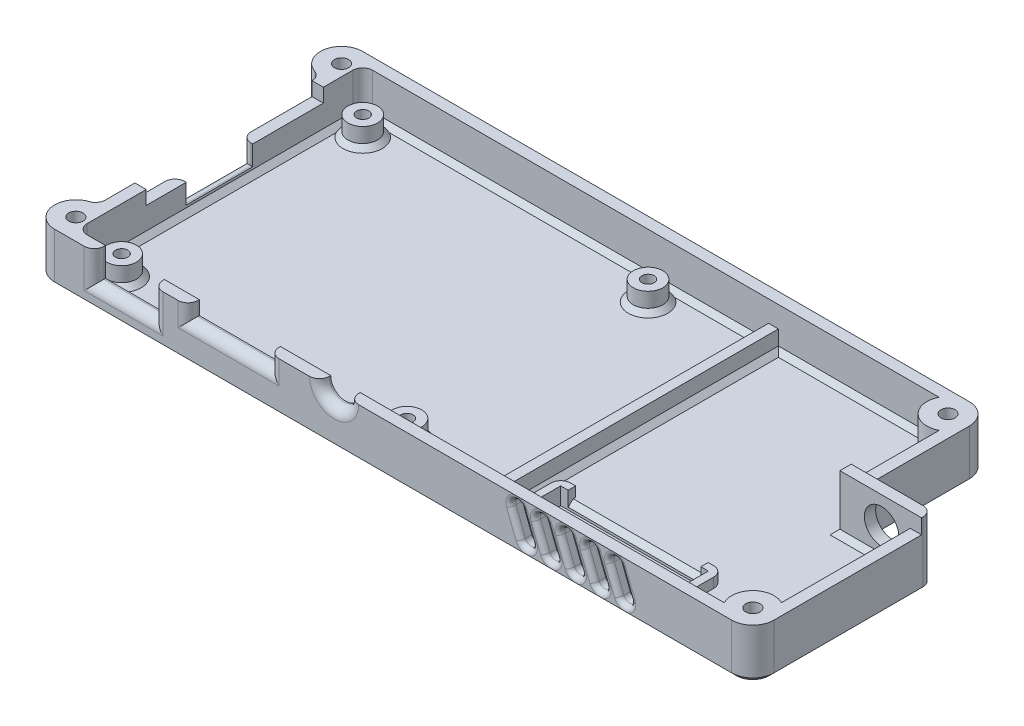
from build123d import *

# Parameters (mm, degrees)
BOSS_EXTRUDE1_DEPTH            = 10.3
BOSS_EXTRUDE2_DEPTH            = 2
SKETCH6_R                      = 3
BOSS_EXTRUDE3_DEPTH            = 4
F_2_5_2_5_DIAMETER_HOLE1_D     = 2.5
F_2_5_2_5_DIAMETER_HOLE1_DEPTH = 8
F_2_5_2_5_DIAMETER_HOLE1_TIP   = 0.751075774
SKETCH10_W                     = 2
SKETCH10_H                     = 58
BOSS_EXTRUDE4_DEPTH            = 4
CUT_EXTRUDE1_REACH             = 100.128
SKETCH11_R                     = 3
SKETCH11_W                     = 12
SKETCH11_H                     = 5.8
SKETCH11_W_2                   = 16.5
SKETCH11_H_2                   = 2.8
CUT_EXTRUDE2_REACH             = 148.374
SKETCH12_W                     = 13.5
SKETCH12_H                     = 6.8
SKETCH12_W_2                   = 36
SKETCH12_H_2                   = 2.8
FILLET6_R                      = 2
FILLET8_R                      = 2
CHAMFER1_SIZE                  = 1
FILLET9_R                      = 2
SKETCH14_W                     = 16.6
SKETCH14_H                     = 2.3
BOSS_EXTRUDE5_DEPTH            = 3
CUT_EXTRUDE3_REACH             = 86.384
SKETCH13_R                     = 3.5
BOSS_EXTRUDE6_DEPTH            = 10.3
F_2_9_2_9_DIAMETER_HOLE2_D     = 2.9
F_2_9_2_9_DIAMETER_HOLE1_D     = 2.9
BOSS_EXTRUDE7_REACH            = 89.052
SKETCH24_R                     = 4.3
F_2_9_2_9_DIAMETER_HOLE3_D     = 2.9
F_2_9_2_9_DIAMETER_HOLE4_D     = 2.9
FILLET10_R                     = 4.3
FILLET16_R                     = 4.3
FILLET17_R                     = 2
FILLET18_R                     = 2
FILLET19_R                     = 2
SKETCH29_W                     = 30.1
SKETCH29_H                     = 10.25
CUT_EXTRUDE4_DEPTH             = 1.5
CUT_EXTRUDE4_DIRECTION_2_REACH = 89.052
BOSS_EXTRUDE8_DEPTH            = 2
CHAMFER3_SIZE                  = 1
FILLET20_R                     = 2
CUT_EXTRUDE5_REACH             = 103.795
CHAMFER5_SIZE                  = 1
FILLET21_R                     = 1


with BuildPart() as part:
    # Sketch3 → Boss-Extrude1 (new body)
    with BuildSketch(Plane(origin=(0, 0, 0), x_dir=(1, 0, 0), z_dir=(0, 1, 0))):
        Polygon((52.738233838, 8.405993834), (67.038233838, 8.405993834), (67.038233838, -28.194006166), (52.738233838, -28.194006166), (-74.861766162, -28.194006166), (-74.861766162, 34.405993834), (52.738233838, 34.405993834), align=None)
        Polygon((55.038233838, -25.894006166), (64.738233838, -25.894006166), (64.738233838, 6.105993834), (50.438233838, 6.105993834), (50.438233838, 32.105993834), (-72.561766162, 32.105993834), (-72.561766162, -25.894006166), (50.438233838, -25.894006166), align=None, mode=Mode.SUBTRACT)
    extrude(amount=BOSS_EXTRUDE1_DEPTH)

    # Sketch5 → Boss-Extrude2 (add)
    with BuildSketch(Plane(origin=(0, 0, 0), x_dir=(1, 0, 0), z_dir=(0, 1, 0))):
        Polygon((-72.561766162, 32.105993834), (50.438233838, 32.105993834), (50.438233838, 6.105993834), (64.738233838, 6.105993834), (64.738233838, -25.894006166), (50.438233838, -25.894006166), (-72.561766162, -25.894006166), align=None)
    extrude(amount=BOSS_EXTRUDE2_DEPTH)

    # Sketch6 → Boss-Extrude3 (add)
    with BuildSketch(Plane(origin=(0, 2, 0), x_dir=(1, 0, 0), z_dir=(0, 1, 0))):
        with Locations(Location((-68.061766162, 27.605993834, 0), (0, 0, 270))):
            Circle(SKETCH6_R)
        with Locations(Location((-68.061766162, -21.394006166, 0), (0, 0, 270))):
            Circle(SKETCH6_R)
        with Locations(Location((-10.061766162, -21.394006166, 0), (0, 0, 270))):
            Circle(SKETCH6_R)
        with Locations(Location((-10.061766162, 27.605993834, 0), (0, 0, 270))):
            Circle(SKETCH6_R)
    extrude(amount=BOSS_EXTRUDE3_DEPTH)

    # Ø2.5 (2.5) Diameter Hole1
    with Locations(Plane(origin=(0, 6, 0), x_dir=(1, 0, 0), z_dir=(0, 1, 0))):
        with Locations((-68.061766162, 27.605993834), (-10.061766162, 27.605993834), (-10.061766162, -21.394006166), (-68.061766162, -21.394006166)):
            Hole(F_2_5_2_5_DIAMETER_HOLE1_D / 2, depth=F_2_5_2_5_DIAMETER_HOLE1_DEPTH)
            with Locations((0, 0, -(F_2_5_2_5_DIAMETER_HOLE1_DEPTH + F_2_5_2_5_DIAMETER_HOLE1_TIP / 2))):  # 118° drill point
                Cone(0, F_2_5_2_5_DIAMETER_HOLE1_D / 2, F_2_5_2_5_DIAMETER_HOLE1_TIP, mode=Mode.SUBTRACT)

    # Sketch10 → Boss-Extrude4 (add)
    with BuildSketch(Plane(origin=(0, 2, 0), x_dir=(1, 0, 0), z_dir=(0, 1, 0))):
        with Locations((10.938233838, 3.105993834)):
            Rectangle(SKETCH10_W, SKETCH10_H)
    extrude(amount=BOSS_EXTRUDE4_DEPTH)

    # Sketch11 → Cut-Extrude1 (cut, up to next)
    with BuildSketch(Plane.XY.offset(28.194006166), mode=Mode.PRIVATE) as cut_extrude1_sk1:
        with Locations((-18.061766162, 10.3)):
            Circle(SKETCH11_R)
    cut_extrude1_tool1 = extrude(cut_extrude1_sk1.sketch, amount=-CUT_EXTRUDE1_REACH, mode=Mode.PRIVATE) & part.part
    # Sketch11 → Cut-Extrude1 (cut, up to next)
    with BuildSketch(Plane.XY.offset(28.194006166), mode=Mode.PRIVATE) as cut_extrude1_sk2:
        with Locations((-60.861766162, 7.4)):
            Rectangle(SKETCH11_W, SKETCH11_H)
    cut_extrude1_tool2 = extrude(cut_extrude1_sk2.sketch, amount=-CUT_EXTRUDE1_REACH, mode=Mode.PRIVATE) & part.part
    # Sketch11 → Cut-Extrude1 (cut, up to next)
    with BuildSketch(Plane.XY.offset(28.194006166), mode=Mode.PRIVATE) as cut_extrude1_sk3:
        with Locations((-39.527982648, 8.9)):
            Rectangle(SKETCH11_W_2, SKETCH11_H_2)
    cut_extrude1_tool3 = extrude(cut_extrude1_sk3.sketch, amount=-CUT_EXTRUDE1_REACH, mode=Mode.PRIVATE) & part.part
    add(cut_extrude1_tool1.solids().sort_by_distance((-18.061766, 10.3, 28.194006))[0], mode=Mode.SUBTRACT)
    add(cut_extrude1_tool2.solids().sort_by_distance((-60.861766, 7.4, 28.194006))[0], mode=Mode.SUBTRACT)
    add(cut_extrude1_tool3.solids().sort_by_distance((-39.527983, 8.9, 28.194006))[0], mode=Mode.SUBTRACT)

    # Sketch12 → Cut-Extrude2 (cut, up to next)
    with BuildSketch(Plane.ZY.offset(74.861766162), mode=Mode.PRIVATE) as cut_extrude2_sk1:
        with Locations((-2.982922372, 6.9)):
            Rectangle(SKETCH12_W, SKETCH12_H)
    cut_extrude2_tool1 = extrude(cut_extrude2_sk1.sketch, amount=-CUT_EXTRUDE2_REACH, mode=Mode.PRIVATE) & part.part
    # Sketch12 → Cut-Extrude2 (cut, up to next)
    with BuildSketch(Plane.ZY.offset(74.861766162), mode=Mode.PRIVATE) as cut_extrude2_sk2:
        with Locations((-6.105993834, 8.9)):
            Rectangle(SKETCH12_W_2, SKETCH12_H_2)
    cut_extrude2_tool2 = extrude(cut_extrude2_sk2.sketch, amount=-CUT_EXTRUDE2_REACH, mode=Mode.PRIVATE) & part.part
    add(cut_extrude2_tool1.solids().sort_by_distance((-74.861766, 6.9, -2.982922))[0], mode=Mode.SUBTRACT)
    add(cut_extrude2_tool2.solids().sort_by_distance((-74.861766, 8.9, -6.105994))[0], mode=Mode.SUBTRACT)

    # Fillet6
    fillet6_edges = [part.edges().sort_by_distance(p)[0] for p in [
        (50.438233838, 6.15, -32.105993834),
    ]]
    fillet(fillet6_edges, radius=FILLET6_R)

    # Fillet8
    fillet8_edges = [part.edges().sort_by_distance(p)[0] for p in [
        (-72.561766162, 6.15, -32.105993834),
        (-72.561766162, 6.15, 25.894006166),
    ]]
    fillet(fillet8_edges, radius=FILLET8_R)

    # Chamfer1
    chamfer1_edges = [part.edges().sort_by_distance(p)[0] for p in [
        (-68.061766162, 2, -30.605993834),
        (-68.061766162, 2, 18.394006166),
        (-10.061766162, 2, 18.394006166),
        (-10.061766162, 2, -30.605993834),
    ]]
    chamfer(chamfer1_edges, length=CHAMFER1_SIZE)

    # Chamfer2
    # the kernel refuses this chamfer: 1 mm, written as the material it adds along each edge
    with BuildSketch(Plane(origin=(64.738233838, 2, 25.894006166), x_dir=(0, 0.9996219169112968, 0.027495876610585623), z_dir=(-1, 0, 0))) as chamfer2_piece_1:
        with BuildLine():
            Line((1.028673195, 0), (-0.056547155, 1.027117794))
            Line((-0.056547155, 1.027117794), (-0.076539593, 1.026567876))
            ThreePointArc((-0.076539593, 1.026567876), (-0.034129227, 0.51339783), (-0.019992438, -0.000549918))
            Line((-0.019992438, -0.000549918), (0.000549918, -0.019992438))
            ThreePointArc((0.000549918, -0.019992438), (0.514497665, -0.00585565), (1.029223113, -0.019992438))
            Line((1.029223113, -0.019992438), (1.028673195, 0))
        make_face()
    extrude(amount=52.8)
    with BuildSketch(Plane(origin=(-70.561766162, 2, -32.105993834), x_dir=(0, -0.027495876610586296, 0.9996219169112968), z_dir=(1, 0, 0)), Plane(origin=(9.938233838, 2, 25.894006166), x_dir=(0, -0.02749587661058759, -0.9996219169112968), z_dir=(-1, 0, 0))) as chamfer2_piece_2:
        with BuildLine():
            Line((1.028673195, 0), (-0.056547155, -1.027117794))
            Line((-0.056547155, -1.027117794), (-0.076539593, -1.026567876))
            ThreePointArc((-0.076539593, -1.026567876), (-0.034129227, -0.51339783), (-0.019992438, 0.000549918))
            Line((-0.019992438, 0.000549918), (0.000549918, 0.019992438))
            ThreePointArc((0.000549918, 0.019992438), (0.514497665, 0.00585565), (1.029223113, 0.019992438))
            Line((1.029223113, 0.019992438), (1.028673195, 0))
        make_face()
    extrude(amount=80.5)
    with BuildSketch(Plane(origin=(9.938233838, 2, 25.894006166), x_dir=(-0.9996219169112968, -0.027495876610586556, 0), z_dir=(0, 0, -1))) as chamfer2_piece_3:
        with BuildLine():
            Line((1.028673195, 0), (-0.056547155, 1.027117794))
            Line((-0.056547155, 1.027117794), (-0.076539593, 1.026567876))
            ThreePointArc((-0.076539593, 1.026567876), (-0.034129227, 0.51339783), (-0.019992438, -0.000549918))
            Line((-0.019992438, -0.000549918), (0.000549918, -0.019992438))
            ThreePointArc((0.000549918, -0.019992438), (0.514497665, -0.00585565), (1.029223113, -0.019992438))
            Line((1.029223113, -0.019992438), (1.028673195, 0))
        make_face()
    extrude(amount=58)
    with BuildSketch(Plane(origin=(11.938233838, 2, -32.105993834), x_dir=(-0.027495876610585623, 0.9996219169112968, 0), z_dir=(0, 0, 1))) as chamfer2_piece_4:
        with BuildLine():
            Line((1.028673195, 0), (-0.056547155, -1.027117794))
            Line((-0.056547155, -1.027117794), (-0.076539593, -1.026567876))
            ThreePointArc((-0.076539593, -1.026567876), (-0.034129227, -0.51339783), (-0.019992438, 0.000549918))
            Line((-0.019992438, 0.000549918), (0.000549918, 0.019992438))
            ThreePointArc((0.000549918, 0.019992438), (0.514497665, 0.00585565), (1.029223113, 0.019992438))
            Line((1.029223113, 0.019992438), (1.028673195, 0))
        make_face()
    extrude(amount=58)
    with BuildSketch(Plane(origin=(11.938233838, 2, -32.105993834), x_dir=(0, 0.999621916911297, -0.027495876610582174), z_dir=(1, 0, 0))) as chamfer2_piece_5:
        with BuildLine():
            Line((1.028673195, 0), (-0.056547155, 1.027117794))
            Line((-0.056547155, 1.027117794), (-0.076539593, 1.026567876))
            ThreePointArc((-0.076539593, 1.026567876), (-0.034129227, 0.51339783), (-0.019992438, -0.000549918))
            Line((-0.019992438, -0.000549918), (0.000549918, -0.019992438))
            ThreePointArc((0.000549918, -0.019992438), (0.514497665, -0.00585565), (1.029223113, -0.019992438))
            Line((1.029223113, -0.019992438), (1.028673195, 0))
        make_face()
    extrude(amount=36.5)
    with BuildSketch(Plane(origin=(48.438233838, 2, -30.105993834), x_dir=(0, 0, -1), z_dir=(-1, 0, 0))) as chamfer2_piece_6:
        with BuildLine():
            Line((0.971715729, 0.028284271), (2.028284271, -1.028284271))
            Line((2.028284271, -1.028284271), (2.048284271, -1.028284271))
            ThreePointArc((2.048284271, -1.028284271), (2.02, -0.514142136), (2.02, 0))
            Line((2.02, 0), (2, 0.02))
            ThreePointArc((2, 0.02), (1.485857864, 0.02), (0.971715729, 0.048284271))
            Line((0.971715729, 0.048284271), (0.971715729, 0.028284271))
        make_face()
    revolve(axis=Axis((48.438233838, 2, -30.105993834), (0, -1, 0)), revolution_arc=90)
    with BuildSketch(Plane(origin=(-72.561766162, 2, 23.894006166), x_dir=(0.9996219169112968, -0.027495876610586605, 0), z_dir=(0, 0, -1))) as chamfer2_piece_7:
        with BuildLine():
            Line((1.028673195, 0), (-0.056547155, -1.027117794))
            Line((-0.056547155, -1.027117794), (-0.076539593, -1.026567876))
            ThreePointArc((-0.076539593, -1.026567876), (-0.034129227, -0.51339783), (-0.019992438, 0.000549918))
            Line((-0.019992438, 0.000549918), (0.000549918, 0.019992438))
            ThreePointArc((0.000549918, 0.019992438), (0.514497665, 0.00585565), (1.029223113, 0.019992438))
            Line((1.029223113, 0.019992438), (1.028673195, 0))
        make_face()
    extrude(amount=54)
    with BuildSketch(Plane(origin=(-70.561766162, 2, -30.105993834), x_dir=(0, 0, -1), z_dir=(1, 0, 0))) as chamfer2_piece_8:
        with BuildLine():
            Line((0.971715729, -0.028284271), (2.028284271, 1.028284271))
            Line((2.028284271, 1.028284271), (2.048284271, 1.028284271))
            ThreePointArc((2.048284271, 1.028284271), (2.02, 0.514142136), (2.02, 0))
            Line((2.02, 0), (2, -0.02))
            ThreePointArc((2, -0.02), (1.485857864, -0.02), (0.971715729, -0.048284271))
            Line((0.971715729, -0.048284271), (0.971715729, -0.028284271))
        make_face()
    revolve(axis=Axis((-70.561766162, 2, -30.105993834), (0, 1, 0)), revolution_arc=90)
    with BuildSketch(Plane(origin=(-70.561766162, 2, 23.894006166), x_dir=(-1, 0, 0), z_dir=(0, 0, -1))) as chamfer2_piece_9:
        with BuildLine():
            Line((0.971715729, -0.028284271), (2.028284271, 1.028284271))
            Line((2.028284271, 1.028284271), (2.048284271, 1.028284271))
            ThreePointArc((2.048284271, 1.028284271), (2.02, 0.514142136), (2.02, 0))
            Line((2.02, 0), (2, -0.02))
            ThreePointArc((2, -0.02), (1.485857864, -0.02), (0.971715729, -0.048284271))
            Line((0.971715729, -0.048284271), (0.971715729, -0.028284271))
        make_face()
    revolve(axis=Axis((-70.561766162, 2, 23.894006166), (0, 1, 0)), revolution_arc=90)
    with BuildSketch(Plane(origin=(64.738233838, 2, -6.105993834), x_dir=(-0.9996219169112968, -0.027495876610586008, 0), z_dir=(0, 0, 1))) as chamfer2_piece_10:
        with BuildLine():
            Line((1.028673195, 0), (-0.056547155, -1.027117794))
            Line((-0.056547155, -1.027117794), (-0.076539593, -1.026567876))
            ThreePointArc((-0.076539593, -1.026567876), (-0.034129227, -0.51339783), (-0.019992438, 0.000549918))
            Line((-0.019992438, 0.000549918), (0.000549918, 0.019992438))
            ThreePointArc((0.000549918, 0.019992438), (0.514497665, 0.00585565), (1.029223113, 0.019992438))
            Line((1.029223113, 0.019992438), (1.028673195, 0))
        make_face()
    extrude(amount=32)
    with BuildSketch(Plane(origin=(50.438233838, 2, -6.105993834), x_dir=(0, -0.02749587661058627, 0.9996219169112968), z_dir=(1, 0, 0))) as chamfer2_piece_11:
        with BuildLine():
            Line((1.028673195, 0), (-0.056547155, -1.027117794))
            Line((-0.056547155, -1.027117794), (-0.076539593, -1.026567876))
            ThreePointArc((-0.076539593, -1.026567876), (-0.034129227, -0.51339783), (-0.019992438, 0.000549918))
            Line((-0.019992438, 0.000549918), (0.000549918, 0.019992438))
            ThreePointArc((0.000549918, 0.019992438), (0.514497665, 0.00585565), (1.029223113, 0.019992438))
            Line((1.029223113, 0.019992438), (1.028673195, 0))
        make_face()
    extrude(amount=14.3)
    with BuildSketch(Plane(origin=(50.438233838, 2, -30.105993834), x_dir=(-0.9996219169112968, -0.0274958766105862, 0), z_dir=(0, 0, 1))) as chamfer2_piece_12:
        with BuildLine():
            Line((1.028673195, 0), (-0.056547155, -1.027117794))
            Line((-0.056547155, -1.027117794), (-0.076539593, -1.026567876))
            ThreePointArc((-0.076539593, -1.026567876), (-0.034129227, -0.51339783), (-0.019992438, 0.000549918))
            Line((-0.019992438, 0.000549918), (0.000549918, 0.019992438))
            ThreePointArc((0.000549918, 0.019992438), (0.514497665, 0.00585565), (1.029223113, 0.019992438))
            Line((1.029223113, 0.019992438), (1.028673195, 0))
        make_face()
    extrude(amount=24)
    with BuildSketch(Plane(origin=(67.309916826, 2, 25.894006166), x_dir=(0, 0.9996219169112968, 0.027495876610585623), z_dir=(-1, 0, 0))) as chamfer2_piece_13a_section:
        with BuildLine():
            Line((1.028673195, 0), (-0.056547155, 1.027117794))
            Line((-0.056547155, 1.027117794), (-0.076539593, 1.026567876))
            ThreePointArc((-0.076539593, 1.026567876), (-0.034129227, 0.51339783), (-0.019992438, -0.000549918))
            Line((-0.019992438, -0.000549918), (0.000549918, -0.019992438))
            ThreePointArc((0.000549918, -0.019992438), (0.514497665, -0.00585565), (1.029223113, -0.019992438))
            Line((1.029223113, -0.019992438), (1.028673195, 0))
        make_face()
    chamfer2_piece_13a = extrude(amount=55.371682988, mode=Mode.PRIVATE)
    chamfer2_piece_13a = split(chamfer2_piece_13a, bisect_by=Plane(origin=(64.738233838, 2.329793627, 25.564212539), z_dir=(1, 0, 0)), keep=Keep.TOP, mode=Mode.PRIVATE)
    with BuildSketch(Plane(origin=(64.738233838, 2, -6.105993834), x_dir=(-0.9996219169112968, -0.027495876610586008, 0), z_dir=(0, 0, 1))) as chamfer2_piece_13b_section:
        with BuildLine():
            Line((1.028673195, 0), (-0.056547155, -1.027117794))
            Line((-0.056547155, -1.027117794), (-0.076539593, -1.026567876))
            ThreePointArc((-0.076539593, -1.026567876), (-0.034129227, -0.51339783), (-0.019992438, 0.000549918))
            Line((-0.019992438, 0.000549918), (0.000549918, 0.019992438))
            ThreePointArc((0.000549918, 0.019992438), (0.514497665, 0.00585565), (1.029223113, 0.019992438))
            Line((1.029223113, 0.019992438), (1.028673195, 0))
        make_face()
    chamfer2_piece_13b = extrude(amount=34.571682988, mode=Mode.PRIVATE)
    chamfer2_piece_13b = split(chamfer2_piece_13b, bisect_by=Plane(origin=(64.408440211, 2.329793627, 25.894006166), z_dir=(0, 0, 1)), keep=Keep.TOP, mode=Mode.PRIVATE)
    chamfer2_piece_13 = chamfer2_piece_13a & chamfer2_piece_13b
    add(chamfer2_piece_13)
    with BuildSketch(Plane(origin=(64.738233838, 2, 25.894006166), x_dir=(0, 0.9996219169112968, 0.027495876610585623), z_dir=(-1, 0, 0))) as chamfer2_piece_14a_section:
        with BuildLine():
            Line((1.028673195, 0), (-0.056547155, 1.027117794))
            Line((-0.056547155, 1.027117794), (-0.076539593, 1.026567876))
            ThreePointArc((-0.076539593, 1.026567876), (-0.034129227, 0.51339783), (-0.019992438, -0.000549918))
            Line((-0.019992438, -0.000549918), (0.000549918, -0.019992438))
            ThreePointArc((0.000549918, -0.019992438), (0.514497665, -0.00585565), (1.029223113, -0.019992438))
            Line((1.029223113, -0.019992438), (1.028673195, 0))
        make_face()
    chamfer2_piece_14a = extrude(amount=55.371682988, mode=Mode.PRIVATE)
    chamfer2_piece_14a = split(chamfer2_piece_14a, bisect_by=Plane(origin=(11.938233838, 2.329793627, 25.564212539), z_dir=(-1, 0, 0)), keep=Keep.TOP, mode=Mode.PRIVATE)
    with BuildSketch(Plane(origin=(11.938233838, 2, -32.105993834), x_dir=(-0.027495876610585623, 0.9996219169112968, 0), z_dir=(0, 0, 1))) as chamfer2_piece_14b_section:
        with BuildLine():
            Line((1.028673195, 0), (-0.056547155, -1.027117794))
            Line((-0.056547155, -1.027117794), (-0.076539593, -1.026567876))
            ThreePointArc((-0.076539593, -1.026567876), (-0.034129227, -0.51339783), (-0.019992438, 0.000549918))
            Line((-0.019992438, 0.000549918), (0.000549918, 0.019992438))
            ThreePointArc((0.000549918, 0.019992438), (0.514497665, 0.00585565), (1.029223113, 0.019992438))
            Line((1.029223113, 0.019992438), (1.028673195, 0))
        make_face()
    chamfer2_piece_14b = extrude(amount=60.571682988, mode=Mode.PRIVATE)
    chamfer2_piece_14b = split(chamfer2_piece_14b, bisect_by=Plane(origin=(12.268027465, 2.329793627, 25.894006166), z_dir=(0, 0, 1)), keep=Keep.TOP, mode=Mode.PRIVATE)
    chamfer2_piece_14 = chamfer2_piece_14a & chamfer2_piece_14b
    add(chamfer2_piece_14)
    with BuildSketch(Plane(origin=(-70.561766162, 2, -32.105993834), x_dir=(0, -0.027495876610586296, 0.9996219169112968), z_dir=(1, 0, 0))) as chamfer2_piece_15a_section:
        with BuildLine():
            Line((1.028673195, 0), (-0.056547155, -1.027117794))
            Line((-0.056547155, -1.027117794), (-0.076539593, -1.026567876))
            ThreePointArc((-0.076539593, -1.026567876), (-0.034129227, -0.51339783), (-0.019992438, 0.000549918))
            Line((-0.019992438, 0.000549918), (0.000549918, 0.019992438))
            ThreePointArc((0.000549918, 0.019992438), (0.514497665, 0.00585565), (1.029223113, 0.019992438))
            Line((1.029223113, 0.019992438), (1.028673195, 0))
        make_face()
    chamfer2_piece_15a = extrude(amount=83.071682988, mode=Mode.PRIVATE)
    chamfer2_piece_15a = split(chamfer2_piece_15a, bisect_by=Plane(origin=(9.938233838, 2.329793627, -31.776200208), z_dir=(1, 0, 0)), keep=Keep.TOP, mode=Mode.PRIVATE)
    with BuildSketch(Plane(origin=(9.938233838, 2, 25.894006166), x_dir=(-0.9996219169112968, -0.027495876610586556, 0), z_dir=(0, 0, -1))) as chamfer2_piece_15b_section:
        with BuildLine():
            Line((1.028673195, 0), (-0.056547155, 1.027117794))
            Line((-0.056547155, 1.027117794), (-0.076539593, 1.026567876))
            ThreePointArc((-0.076539593, 1.026567876), (-0.034129227, 0.51339783), (-0.019992438, -0.000549918))
            Line((-0.019992438, -0.000549918), (0.000549918, -0.019992438))
            ThreePointArc((0.000549918, -0.019992438), (0.514497665, -0.00585565), (1.029223113, -0.019992438))
            Line((1.029223113, -0.019992438), (1.028673195, 0))
        make_face()
    chamfer2_piece_15b = extrude(amount=60.571682988, mode=Mode.PRIVATE)
    chamfer2_piece_15b = split(chamfer2_piece_15b, bisect_by=Plane(origin=(9.608440211, 2.329793627, -32.105993834), z_dir=(0, 0, -1)), keep=Keep.TOP, mode=Mode.PRIVATE)
    chamfer2_piece_15 = chamfer2_piece_15a & chamfer2_piece_15b
    add(chamfer2_piece_15)
    with BuildSketch(Plane(origin=(12.509916826, 2, 25.894006166), x_dir=(0, -0.027495876610586296, -0.9996219169112968), z_dir=(-1, 0, 0))) as chamfer2_piece_16a_section:
        with BuildLine():
            Line((1.028673195, 0), (-0.056547155, -1.027117794))
            Line((-0.056547155, -1.027117794), (-0.076539593, -1.026567876))
            ThreePointArc((-0.076539593, -1.026567876), (-0.034129227, -0.51339783), (-0.019992438, 0.000549918))
            Line((-0.019992438, 0.000549918), (0.000549918, 0.019992438))
            ThreePointArc((0.000549918, 0.019992438), (0.514497665, 0.00585565), (1.029223113, 0.019992438))
            Line((1.029223113, 0.019992438), (1.028673195, 0))
        make_face()
    chamfer2_piece_16a = extrude(amount=83.071682988, mode=Mode.PRIVATE)
    chamfer2_piece_16a = split(chamfer2_piece_16a, bisect_by=Plane(origin=(9.938233838, 2.329793627, 25.564212539), z_dir=(1, 0, 0)), keep=Keep.TOP, mode=Mode.PRIVATE)
    with BuildSketch(Plane(origin=(9.938233838, 2, 28.465689154), x_dir=(-0.9996219169112968, -0.02749587661058651, 0), z_dir=(0, 0, -1))) as chamfer2_piece_16b_section:
        with BuildLine():
            Line((1.028673195, 0), (-0.056547155, 1.027117794))
            Line((-0.056547155, 1.027117794), (-0.076539593, 1.026567876))
            ThreePointArc((-0.076539593, 1.026567876), (-0.034129227, 0.51339783), (-0.019992438, -0.000549918))
            Line((-0.019992438, -0.000549918), (0.000549918, -0.019992438))
            ThreePointArc((0.000549918, -0.019992438), (0.514497665, -0.00585565), (1.029223113, -0.019992438))
            Line((1.029223113, -0.019992438), (1.028673195, 0))
        make_face()
    chamfer2_piece_16b = extrude(amount=60.571682988, mode=Mode.PRIVATE)
    chamfer2_piece_16b = split(chamfer2_piece_16b, bisect_by=Plane(origin=(9.608440211, 2.329793627, 25.894006166), z_dir=(0, 0, 1)), keep=Keep.TOP, mode=Mode.PRIVATE)
    chamfer2_piece_16 = chamfer2_piece_16a & chamfer2_piece_16b
    add(chamfer2_piece_16)
    with BuildSketch(Plane(origin=(9.36655085, 2, -32.105993834), x_dir=(0, 0.9996219169112968, -0.027495876610589075), z_dir=(1, 0, 0))) as chamfer2_piece_17a_section:
        with BuildLine():
            Line((1.028673195, 0), (-0.056547155, 1.027117794))
            Line((-0.056547155, 1.027117794), (-0.076539593, 1.026567876))
            ThreePointArc((-0.076539593, 1.026567876), (-0.034129227, 0.51339783), (-0.019992438, -0.000549918))
            Line((-0.019992438, -0.000549918), (0.000549918, -0.019992438))
            ThreePointArc((0.000549918, -0.019992438), (0.514497665, -0.00585565), (1.029223113, -0.019992438))
            Line((1.029223113, -0.019992438), (1.028673195, 0))
        make_face()
    chamfer2_piece_17a = extrude(amount=39.071682988, mode=Mode.PRIVATE)
    chamfer2_piece_17a = split(chamfer2_piece_17a, bisect_by=Plane(origin=(11.938233838, 2.329793627, -31.776200208), z_dir=(-1, 0, 0)), keep=Keep.TOP, mode=Mode.PRIVATE)
    with BuildSketch(Plane(origin=(11.938233838, 2, -34.677676822), x_dir=(-0.027495876610585623, 0.9996219169112968, 0), z_dir=(0, 0, 1))) as chamfer2_piece_17b_section:
        with BuildLine():
            Line((1.028673195, 0), (-0.056547155, -1.027117794))
            Line((-0.056547155, -1.027117794), (-0.076539593, -1.026567876))
            ThreePointArc((-0.076539593, -1.026567876), (-0.034129227, -0.51339783), (-0.019992438, 0.000549918))
            Line((-0.019992438, 0.000549918), (0.000549918, 0.019992438))
            ThreePointArc((0.000549918, 0.019992438), (0.514497665, 0.00585565), (1.029223113, 0.019992438))
            Line((1.029223113, 0.019992438), (1.028673195, 0))
        make_face()
    chamfer2_piece_17b = extrude(amount=60.571682988, mode=Mode.PRIVATE)
    chamfer2_piece_17b = split(chamfer2_piece_17b, bisect_by=Plane(origin=(12.268027465, 2.329793627, -32.105993834), z_dir=(0, 0, -1)), keep=Keep.TOP, mode=Mode.PRIVATE)
    chamfer2_piece_17 = chamfer2_piece_17a & chamfer2_piece_17b
    add(chamfer2_piece_17)
    with BuildSketch(Plane(origin=(50.438233838, 2, -6.105993834), x_dir=(0, -0.02749587661058627, 0.9996219169112968), z_dir=(1, 0, 0))) as chamfer2_piece_18a_section:
        with BuildLine():
            Line((1.028673195, 0), (-0.056547155, -1.027117794))
            Line((-0.056547155, -1.027117794), (-0.076539593, -1.026567876))
            ThreePointArc((-0.076539593, -1.026567876), (-0.034129227, -0.51339783), (-0.019992438, 0.000549918))
            Line((-0.019992438, 0.000549918), (0.000549918, 0.019992438))
            ThreePointArc((0.000549918, 0.019992438), (0.514497665, 0.00585565), (1.029223113, 0.019992438))
            Line((1.029223113, 0.019992438), (1.028673195, 0))
        make_face()
    chamfer2_piece_18a = extrude(amount=16.871682988, mode=Mode.PRIVATE)
    chamfer2_piece_18a = split(chamfer2_piece_18a, bisect_by=Plane(origin=(64.738233838, 2.329793627, -5.776200208), z_dir=(1, 0, 0)), keep=Keep.TOP, mode=Mode.PRIVATE)
    with BuildSketch(Plane(origin=(64.738233838, 2, -8.677676822), x_dir=(-0.9996219169112968, -0.027495876610586008, 0), z_dir=(0, 0, 1))) as chamfer2_piece_18b_section:
        with BuildLine():
            Line((1.028673195, 0), (-0.056547155, -1.027117794))
            Line((-0.056547155, -1.027117794), (-0.076539593, -1.026567876))
            ThreePointArc((-0.076539593, -1.026567876), (-0.034129227, -0.51339783), (-0.019992438, 0.000549918))
            Line((-0.019992438, 0.000549918), (0.000549918, 0.019992438))
            ThreePointArc((0.000549918, 0.019992438), (0.514497665, 0.00585565), (1.029223113, 0.019992438))
            Line((1.029223113, 0.019992438), (1.028673195, 0))
        make_face()
    chamfer2_piece_18b = extrude(amount=34.571682988, mode=Mode.PRIVATE)
    chamfer2_piece_18b = split(chamfer2_piece_18b, bisect_by=Plane(origin=(64.408440211, 2.329793627, -6.105993834), z_dir=(0, 0, -1)), keep=Keep.TOP, mode=Mode.PRIVATE)
    chamfer2_piece_18 = chamfer2_piece_18a & chamfer2_piece_18b
    add(chamfer2_piece_18)
    with BuildSketch(Plane(origin=(50.438233838, 2, -30.105993834), x_dir=(-0.9996219169112968, -0.0274958766105862, 0), z_dir=(0, 0, 1))) as chamfer2_piece_19a_section:
        with BuildLine():
            Line((1.028673195, 0), (-0.056547155, -1.027117794))
            Line((-0.056547155, -1.027117794), (-0.076539593, -1.026567876))
            ThreePointArc((-0.076539593, -1.026567876), (-0.034129227, -0.51339783), (-0.019992438, 0.000549918))
            Line((-0.019992438, 0.000549918), (0.000549918, 0.019992438))
            ThreePointArc((0.000549918, 0.019992438), (0.514497665, 0.00585565), (1.029223113, 0.019992438))
            Line((1.029223113, 0.019992438), (1.028673195, 0))
        make_face()
    chamfer2_piece_19a = extrude(amount=26.571682988, mode=Mode.PRIVATE)
    chamfer2_piece_19a = split(chamfer2_piece_19a, bisect_by=Plane(origin=(50.108440211, 2.329793627, -6.105993834), z_dir=(0, 0, 1)), keep=Keep.TOP, mode=Mode.PRIVATE)
    with BuildSketch(Plane(origin=(47.86655085, 2, -6.105993834), x_dir=(0, -0.02749587661058627, 0.9996219169112968), z_dir=(1, 0, 0))) as chamfer2_piece_19b_section:
        with BuildLine():
            Line((1.028673195, 0), (-0.056547155, -1.027117794))
            Line((-0.056547155, -1.027117794), (-0.076539593, -1.026567876))
            ThreePointArc((-0.076539593, -1.026567876), (-0.034129227, -0.51339783), (-0.019992438, 0.000549918))
            Line((-0.019992438, 0.000549918), (0.000549918, 0.019992438))
            ThreePointArc((0.000549918, 0.019992438), (0.514497665, 0.00585565), (1.029223113, 0.019992438))
            Line((1.029223113, 0.019992438), (1.028673195, 0))
        make_face()
    chamfer2_piece_19b = extrude(amount=16.871682988, mode=Mode.PRIVATE)
    chamfer2_piece_19b = split(chamfer2_piece_19b, bisect_by=Plane(origin=(50.438233838, 2.329793627, -5.776200208), z_dir=(-1, 0, 0)), keep=Keep.TOP, mode=Mode.PRIVATE)
    chamfer2_piece_19 = chamfer2_piece_19a & chamfer2_piece_19b
    add(chamfer2_piece_19)

    # Fillet9
    fillet9_edges = [part.edges().sort_by_distance(p)[0] for p in [
        (-60.861766162, 4.5, 28.194006166),
        (-54.861766162, 7.4, 28.194006166),
        (-47.777982648, 8.9, 28.194006166),
        (-39.527982648, 7.5, 28.194006166),
        (-31.277982648, 8.9, 28.194006166),
        (-18.061766162, 7.3, 28.194006166),
        (-74.861766162, 5.5, -9.732922372),
        (-74.861766162, 3.5, -2.982922372),
        (-74.861766162, 5.5, 3.767077628),
    ]]
    fillet(fillet9_edges, radius=FILLET9_R)

    # Sketch14 → Boss-Extrude5 (add)
    with BuildSketch(Plane(origin=(0, 10.3, 0), x_dir=(1, 0, 0), z_dir=(0, 1, 0))):
        with Locations((58.738233838, 7.255993834)):
            Rectangle(SKETCH14_W, SKETCH14_H)
    extrude(amount=BOSS_EXTRUDE5_DEPTH)

    # Sketch13 → Cut-Extrude3 (cut, up to next)
    with BuildSketch(Plane(origin=(0, 0, -8.405993834), x_dir=(-1, 0, 0), z_dir=(0, 0, -1)), mode=Mode.PRIVATE) as cut_extrude3_sk1:
        with Locations((-58.908959679, 7.722271929)):
            Circle(SKETCH13_R)
    cut_extrude3_tool1 = extrude(cut_extrude3_sk1.sketch, amount=-CUT_EXTRUDE3_REACH, mode=Mode.PRIVATE) & part.part
    add(cut_extrude3_tool1.solids().sort_by_distance((58.90896, 7.722272, -8.405994))[0], mode=Mode.SUBTRACT)

    # Sketch17 → Boss-Extrude6 (add)
    with BuildSketch(Plane(origin=(0, 0, 0), x_dir=(1, 0, 0), z_dir=(0, 1, 0))):
        with BuildLine():
            Line((-74.861766162, 34.405993834), (-74.861766162, 25.805993834))
            ThreePointArc((-74.861766162, 25.805993834), (-79.161766162, 30.105993834), (-74.861766162, 34.405993834))
        make_face()
        with BuildLine():
            Line((-74.861766162, -19.594006166), (-74.861766162, -28.194006166))
            ThreePointArc((-74.861766162, -28.194006166), (-79.161766162, -23.894006166), (-74.861766162, -19.594006166))
        make_face()
    extrude(amount=BOSS_EXTRUDE6_DEPTH)

    # Ø2.9 (2.9) Diameter Hole2 (through all)
    with Locations(Plane(origin=(0, 10.3, 0), x_dir=(1, 0, 0), z_dir=(0, 1, 0))):
        with Locations((-74.861766162, 30.105993834)):
            Hole(F_2_9_2_9_DIAMETER_HOLE2_D / 2)

    # Ø2.9 (2.9) Diameter Hole1 (through all)
    with Locations(Plane(origin=(0, 10.3, 0), x_dir=(1, 0, 0), z_dir=(0, 1, 0))):
        with Locations((-74.861766162, -23.894006166)):
            Hole(F_2_9_2_9_DIAMETER_HOLE1_D / 2)

    # Boss-Extrude7: up to this face of the body (flat: up to its plane)
    boss_extrude7_end = Plane(part.part.faces().sort_by_distance((-74.050055774, 10.3, 22.517680386))[0])
    # Sketch24 → Boss-Extrude7 (add, up to the picked face)
    with BuildSketch(Plane(origin=(0, 2, 0), x_dir=(1, 0, 0), z_dir=(0, 1, 0)), mode=Mode.PRIVATE) as boss_extrude7_sk1:
        with Locations((62.738431143, -23.885848487)):
            Circle(SKETCH24_R)
    boss_extrude7_tool1 = split(extrude(boss_extrude7_sk1.sketch, amount=BOSS_EXTRUDE7_REACH, mode=Mode.PRIVATE), bisect_by=boss_extrude7_end, keep=Keep.BOTH, mode=Mode.PRIVATE)
    # Sketch24 → Boss-Extrude7 (add, up to the picked face)
    with BuildSketch(Plane(origin=(0, 2, 0), x_dir=(1, 0, 0), z_dir=(0, 1, 0)), mode=Mode.PRIVATE) as boss_extrude7_sk2:
        with Locations((48.418494527, 30.105993834)):
            Circle(SKETCH24_R)
    boss_extrude7_tool2 = split(extrude(boss_extrude7_sk2.sketch, amount=BOSS_EXTRUDE7_REACH, mode=Mode.PRIVATE), bisect_by=boss_extrude7_end, keep=Keep.BOTH, mode=Mode.PRIVATE)
    add(boss_extrude7_tool1.solids().sort_by(Axis((62.738431, 2, 23.885848), (0, 1, 0)))[0])
    add(boss_extrude7_tool2.solids().sort_by(Axis((48.418495, 2, -30.105994), (0, 1, 0)))[0])

    # Ø2.9 (2.9) Diameter Hole3 (through all)
    with Locations(Plane(origin=(0, 10.3, 0), x_dir=(1, 0, 0), z_dir=(0, 1, 0))):
        with Locations((62.738431143, -23.885848487)):
            Hole(F_2_9_2_9_DIAMETER_HOLE3_D / 2)

    # Ø2.9 (2.9) Diameter Hole4 (through all)
    with Locations(Plane(origin=(0, 10.3, 0), x_dir=(1, 0, 0), z_dir=(0, 1, 0))):
        with Locations((48.418494527, 30.105993834)):
            Hole(F_2_9_2_9_DIAMETER_HOLE4_D / 2)

    # Fillet10
    fillet10_edges = [part.edges().sort_by_distance(p)[0] for p in [
        (52.738233838, 5.15, -34.405993834),
    ]]
    fillet(fillet10_edges, radius=FILLET10_R)

    # Fillet16
    # the kernel refuses this fillet: 4.3 mm, written as the material it takes off along each edge
    with BuildSketch(Plane(origin=(67.038233838, -10.75, 28.194006166), x_dir=(0, 0, -1), z_dir=(0, 1, 0))) as fillet16_piece_1:
        with BuildLine():
            CenterArc((FILLET16_R, FILLET16_R), FILLET16_R, 180, 90)
            Line((0, FILLET16_R), (0, 0))
            Line((0, 0), (FILLET16_R, 0))
        make_face()
    extrude(amount=31.8, mode=Mode.SUBTRACT)

    # Fillet17
    fillet17_edges = [part.edges().sort_by_distance(p)[0] for p in [
        (52.738233838, 5.15, -8.405993834),
        (67.038233838, 6.65, -8.405993834),
    ]]
    fillet(fillet17_edges, radius=FILLET17_R)

    # Fillet18
    fillet18_edges = [part.edges().sort_by_distance(p)[0] for p in [
        (-74.861766162, 5.15, -25.805993834),
        (-74.861766162, 5.15, 19.594006166),
    ]]
    fillet(fillet18_edges, radius=FILLET18_R)

    # Fillet19
    fillet19_edges = [part.edges().sort_by_distance(p)[0] for p in [
        (-66.861766162, 6.4, 28.194006166),
    ]]
    fillet(fillet19_edges, radius=FILLET19_R)

    # Sketch29 → Cut-Extrude4 (cut)
    with BuildSketch(Plane(origin=(0, 2, 0), x_dir=(1, 0, 0), z_dir=(0, 1, 0))):
        with Locations((30.488233838, -20.769006166)):
            Rectangle(SKETCH29_W, SKETCH29_H)
    extrude(amount=-CUT_EXTRUDE4_DEPTH, mode=Mode.SUBTRACT)

    # Sketch29 → Cut-Extrude4 direction 2 (cut, up to next)
    with BuildSketch(Plane(origin=(0, 2, 0), x_dir=(1, 0, 0), z_dir=(0, 1, 0)), mode=Mode.PRIVATE) as cut_extrude4_direction_2_sk1:
        with Locations((30.488233838, -20.769006166)):
            Rectangle(SKETCH29_W, SKETCH29_H)
    cut_extrude4_direction_2_tool1 = extrude(cut_extrude4_direction_2_sk1.sketch, amount=CUT_EXTRUDE4_DIRECTION_2_REACH, mode=Mode.PRIVATE) & part.part
    add(cut_extrude4_direction_2_tool1.solids().sort_by_distance((30.488234, 2, 20.769006))[0], mode=Mode.SUBTRACT)

    # Sketch30 → Boss-Extrude8 (add)
    with BuildSketch(Plane(origin=(0, 2, 0), x_dir=(1, 0, 0), z_dir=(0, 1, 0))):
        Polygon((13.938233838, -25.908422091), (15.438233838, -25.894006166), (15.438233838, -15.644006166), (16.959333041, -15.644006166), (16.959333041, -14.144006166), (13.938233838, -14.144006166), align=None)
        Polygon((45.438233838, -15.644006166), (45.438233838, -25.894006166), (47.038233838, -25.894006166), (47.038233838, -14.144006166), (43.917134635, -14.144006166), (43.917134635, -15.644006166), align=None)
    extrude(amount=BOSS_EXTRUDE8_DEPTH)

    # Chamfer3
    chamfer3_edges = [part.edges().sort_by_distance(p)[0] for p in [
        (30.438233838, 2, 15.644006166),
    ]]
    chamfer(chamfer3_edges, length=CHAMFER3_SIZE)

    # Fillet20
    fillet20_edges = [part.edges().sort_by_distance(p)[0] for p in [
        (13.938233838, 3, 14.144006166),
        (47.038233838, 3, 14.144006166),
    ]]
    fillet(fillet20_edges, radius=FILLET20_R)

    # Sketch31 → Cut-Extrude5 (cut, up to next)
    with BuildSketch(Plane.XY.offset(28.194006166), mode=Mode.PRIVATE) as cut_extrude5_sk1:
        with BuildLine():
            Line((20.245745407, 8.572350221), (22.162062151, 3.630920252))
            ThreePointArc((22.162062151, 3.630920252), (21.448592051, 2.01352716), (19.831198958, 2.72699726))
            Line((19.831198958, 2.72699726), (17.914882214, 7.668427229))
            ThreePointArc((17.914882214, 7.668427229), (18.628352315, 9.285820322), (20.245745407, 8.572350221))
        make_face()
    cut_extrude5_tool1 = extrude(cut_extrude5_sk1.sketch, amount=-CUT_EXTRUDE5_REACH, mode=Mode.PRIVATE) & part.part
    # Sketch31 → Cut-Extrude5 (cut, up to next)
    with BuildSketch(Plane.XY.offset(28.194006166), mode=Mode.PRIVATE) as cut_extrude5_sk2:
        with BuildLine():
            Line((25.245745407, 8.572350221), (27.162062151, 3.630920252))
            ThreePointArc((27.162062151, 3.630920252), (26.448592051, 2.01352716), (24.831198958, 2.72699726))
            Line((24.831198958, 2.72699726), (22.914882214, 7.668427229))
            ThreePointArc((22.914882214, 7.668427229), (23.628352315, 9.285820322), (25.245745407, 8.572350221))
        make_face()
    cut_extrude5_tool2 = extrude(cut_extrude5_sk2.sketch, amount=-CUT_EXTRUDE5_REACH, mode=Mode.PRIVATE) & part.part
    # Sketch31 → Cut-Extrude5 (cut, up to next)
    with BuildSketch(Plane.XY.offset(28.194006166), mode=Mode.PRIVATE) as cut_extrude5_sk3:
        with BuildLine():
            Line((30.245745407, 8.572350221), (32.162062151, 3.630920252))
            ThreePointArc((32.162062151, 3.630920252), (31.448592051, 2.01352716), (29.831198958, 2.72699726))
            Line((29.831198958, 2.72699726), (27.914882214, 7.668427229))
            ThreePointArc((27.914882214, 7.668427229), (28.628352315, 9.285820322), (30.245745407, 8.572350221))
        make_face()
    cut_extrude5_tool3 = extrude(cut_extrude5_sk3.sketch, amount=-CUT_EXTRUDE5_REACH, mode=Mode.PRIVATE) & part.part
    # Sketch31 → Cut-Extrude5 (cut, up to next)
    with BuildSketch(Plane.XY.offset(28.194006166), mode=Mode.PRIVATE) as cut_extrude5_sk4:
        with BuildLine():
            Line((35.245745407, 8.572350221), (37.162062151, 3.630920252))
            ThreePointArc((37.162062151, 3.630920252), (36.448592051, 2.01352716), (34.831198958, 2.72699726))
            Line((34.831198958, 2.72699726), (32.914882214, 7.668427229))
            ThreePointArc((32.914882214, 7.668427229), (33.628352315, 9.285820322), (35.245745407, 8.572350221))
        make_face()
    cut_extrude5_tool4 = extrude(cut_extrude5_sk4.sketch, amount=-CUT_EXTRUDE5_REACH, mode=Mode.PRIVATE) & part.part
    # Sketch31 → Cut-Extrude5 (cut, up to next)
    with BuildSketch(Plane.XY.offset(28.194006166), mode=Mode.PRIVATE) as cut_extrude5_sk5:
        with BuildLine():
            Line((40.245745407, 8.572350221), (42.162062151, 3.630920252))
            ThreePointArc((42.162062151, 3.630920252), (41.448592051, 2.01352716), (39.831198958, 2.72699726))
            Line((39.831198958, 2.72699726), (37.914882214, 7.668427229))
            ThreePointArc((37.914882214, 7.668427229), (38.628352315, 9.285820322), (40.245745407, 8.572350221))
        make_face()
    cut_extrude5_tool5 = extrude(cut_extrude5_sk5.sketch, amount=-CUT_EXTRUDE5_REACH, mode=Mode.PRIVATE) & part.part
    add(cut_extrude5_tool1.solids().sort_by_distance((20.038472, 5.649674, 28.194006))[0], mode=Mode.SUBTRACT)
    add(cut_extrude5_tool2.solids().sort_by_distance((25.038472, 5.649674, 28.194006))[0], mode=Mode.SUBTRACT)
    add(cut_extrude5_tool3.solids().sort_by_distance((30.038472, 5.649674, 28.194006))[0], mode=Mode.SUBTRACT)
    add(cut_extrude5_tool4.solids().sort_by_distance((35.038472, 5.649674, 28.194006))[0], mode=Mode.SUBTRACT)
    add(cut_extrude5_tool5.solids().sort_by_distance((40.038472, 5.649674, 28.194006))[0], mode=Mode.SUBTRACT)

    # Chamfer5
    chamfer5_edges = [part.edges().sort_by_distance(p)[0] for p in [
        (-79.105793795, 0, -30.797535193),
        (-13.211766162, 0, -34.405993834),
        (51.478792997, 0, -33.146552993),
        (67.038233838, 0, 8.744006166),
        (65.778792997, 0, 26.934565325),
        (52.738233838, 0, -20.255993834),
        (59.888233838, 0, -8.405993834),
        (66.4524474, 0, -7.820207397),
        (53.324020275, 0, -8.991780272),
        (-79.105793795, 0, 24.585547524),
        (-74.861766162, 0, -3.105993834),
        (-75.2385223, 0, 19.088261462),
        (-75.2385223, 0, -25.300249131),
        (-6.061766162, 0, 28.194006166),
    ]]
    chamfer(chamfer5_edges, length=CHAMFER5_SIZE)

    # Fillet21
    # the kernel refuses this fillet: 1 mm, written as the material it takes off along each edge
    with BuildSketch(Plane(origin=(19.080313811, 8.120388725, 28.194006166), x_dir=(-0.9323452771444887, -0.3615691969545617, 0), z_dir=(0.3615691969545617, -0.9323452771444887, 0))) as fillet21_piece_1:
        with BuildLine():
            CenterArc((1.25 + FILLET21_R, FILLET21_R), FILLET21_R, 180, 90)
            Line((1.25, FILLET21_R), (1.25, 0))
            Line((1.25, 0), (1.25 + FILLET21_R, 0))
        make_face()
    revolve(axis=Axis((19.080313811, 8.120388725, 28.194006166), (0, 0, -1)), revolution_arc=180, mode=Mode.SUBTRACT)
    with BuildSketch(Plane(origin=(19.831198958, 2.72699726, 28.194006166), x_dir=(-0.9323452771444881, -0.361569196954563, 2.1316282072802996e-14), z_dir=(-0.361569196954563, 0.9323452771444882, 0)), Plane(origin=(20.245745407, 8.572350221, 28.194006166), x_dir=(0.9323452771444893, 0.36156919695456025, 2.131628207280302e-14), z_dir=(0.36156919695456025, -0.9323452771444892, 0)), Plane(origin=(24.831198958, 2.72699726, 28.194006166), x_dir=(-0.932345277144489, -0.36156919695456113, 2.486899575160352e-14), z_dir=(-0.36156919695456113, 0.932345277144489, 0)), Plane(origin=(25.245745407, 8.572350221, 28.194006166), x_dir=(0.9323452771444893, 0.36156919695456025, 2.8421709430404026e-14), z_dir=(0.36156919695456025, -0.9323452771444892, 0)), Plane(origin=(29.831198958, 2.72699726, 28.194006166), x_dir=(-0.9323452771444894, -0.36156919695455975, 2.842170943040403e-14), z_dir=(-0.3615691969545597, 0.9323452771444894, 0)), Plane(origin=(30.245745407, 8.572350221, 28.194006166), x_dir=(0.9323452771444888, 0.36156919695456163, 3.1974423109204635e-14), z_dir=(0.36156919695456163, -0.9323452771444887, 0)), Plane(origin=(34.831198958, 2.72699726, 28.194006166), x_dir=(-0.9323452771444888, -0.3615691969545616, 3.55271367880049e-14), z_dir=(-0.3615691969545616, 0.9323452771444888, 0)), Plane(origin=(35.245745407, 8.572350221, 28.194006166), x_dir=(0.9323452771444888, 0.3615691969545615, 3.5527136788005154e-14), z_dir=(0.3615691969545616, -0.9323452771444888, 0)), Plane(origin=(39.831198958, 2.72699726, 28.194006166), x_dir=(-0.9323452771444887, -0.36156919695456174, 3.907985046680538e-14), z_dir=(-0.3615691969545618, 0.9323452771444887, 0)), Plane(origin=(40.245745407, 8.572350221, 28.194006166), x_dir=(0.9323452771444897, 0.3615691969545591, 4.263256414560593e-14), z_dir=(0.3615691969545591, -0.9323452771444897, 0))) as fillet21_piece_2:
        with BuildLine():
            CenterArc((FILLET21_R, -FILLET21_R), FILLET21_R, 90, 90)
            Line((0, -FILLET21_R), (0, 0))
            Line((0, 0), (FILLET21_R, 0))
        make_face()
    extrude(amount=5.3, mode=Mode.SUBTRACT)
    with BuildSketch(Plane(origin=(20.996630555, 3.178958756, 28.194006166), x_dir=(0.9323452771444888, 0.3615691969545614, 0), z_dir=(-0.3615691969545614, 0.9323452771444888, 0))) as fillet21_piece_3:
        with BuildLine():
            CenterArc((1.25 + FILLET21_R, FILLET21_R), FILLET21_R, 180, 90)
            Line((1.25, FILLET21_R), (1.25, 0))
            Line((1.25, 0), (1.25 + FILLET21_R, 0))
        make_face()
    revolve(axis=Axis((20.996630555, 3.178958756, 28.194006166), (0, 0, -1)), revolution_arc=180, mode=Mode.SUBTRACT)
    with BuildSketch(Plane(origin=(24.080313811, 8.120388725, 28.194006166), x_dir=(-0.9323452771444873, -0.3615691969545651, 0), z_dir=(0.3615691969545651, -0.9323452771444873, 0))) as fillet21_piece_4:
        with BuildLine():
            CenterArc((1.25 + FILLET21_R, FILLET21_R), FILLET21_R, 180, 90)
            Line((1.25, FILLET21_R), (1.25, 0))
            Line((1.25, 0), (1.25 + FILLET21_R, 0))
        make_face()
    revolve(axis=Axis((24.080313811, 8.120388725, 28.194006166), (0, 0, -1)), revolution_arc=180, mode=Mode.SUBTRACT)
    with BuildSketch(Plane(origin=(25.996630555, 3.178958756, 28.194006166), x_dir=(0.9323452771444887, 0.3615691969545617, 0), z_dir=(-0.3615691969545617, 0.9323452771444887, 0))) as fillet21_piece_5:
        with BuildLine():
            CenterArc((1.25 + FILLET21_R, FILLET21_R), FILLET21_R, 180, 90)
            Line((1.25, FILLET21_R), (1.25, 0))
            Line((1.25, 0), (1.25 + FILLET21_R, 0))
        make_face()
    revolve(axis=Axis((25.996630555, 3.178958756, 28.194006166), (0, 0, -1)), revolution_arc=180, mode=Mode.SUBTRACT)
    with BuildSketch(Plane(origin=(29.080313811, 8.120388725, 28.194006166), x_dir=(-0.9323452771444889, -0.361569196954561, 0), z_dir=(0.361569196954561, -0.9323452771444889, 0))) as fillet21_piece_6:
        with BuildLine():
            CenterArc((1.25 + FILLET21_R, FILLET21_R), FILLET21_R, 180, 90)
            Line((1.25, FILLET21_R), (1.25, 0))
            Line((1.25, 0), (1.25 + FILLET21_R, 0))
        make_face()
    revolve(axis=Axis((29.080313811, 8.120388725, 28.194006166), (0, 0, -1)), revolution_arc=180, mode=Mode.SUBTRACT)
    with BuildSketch(Plane(origin=(30.996630555, 3.178958756, 28.194006166), x_dir=(0.9323452771444879, 0.3615691969545638, 0), z_dir=(-0.3615691969545638, 0.9323452771444879, 0))) as fillet21_piece_7:
        with BuildLine():
            CenterArc((1.25 + FILLET21_R, FILLET21_R), FILLET21_R, 180, 90)
            Line((1.25, FILLET21_R), (1.25, 0))
            Line((1.25, 0), (1.25 + FILLET21_R, 0))
        make_face()
    revolve(axis=Axis((30.996630555, 3.178958756, 28.194006166), (0, 0, -1)), revolution_arc=180, mode=Mode.SUBTRACT)
    with BuildSketch(Plane(origin=(34.080313811, 8.120388725, 28.194006166), x_dir=(-0.9323452771444893, -0.3615691969545598, 0), z_dir=(0.3615691969545598, -0.9323452771444893, 0))) as fillet21_piece_8:
        with BuildLine():
            CenterArc((1.25 + FILLET21_R, FILLET21_R), FILLET21_R, 180, 90)
            Line((1.25, FILLET21_R), (1.25, 0))
            Line((1.25, 0), (1.25 + FILLET21_R, 0))
        make_face()
    revolve(axis=Axis((34.080313811, 8.120388725, 28.194006166), (0, 0, -1)), revolution_arc=180, mode=Mode.SUBTRACT)
    with BuildSketch(Plane(origin=(35.996630555, 3.178958756, 28.194006166), x_dir=(0.9323452771444896, 0.3615691969545595, 0), z_dir=(-0.3615691969545595, 0.9323452771444896, 0))) as fillet21_piece_9:
        with BuildLine():
            CenterArc((1.25 + FILLET21_R, FILLET21_R), FILLET21_R, 180, 90)
            Line((1.25, FILLET21_R), (1.25, 0))
            Line((1.25, 0), (1.25 + FILLET21_R, 0))
        make_face()
    revolve(axis=Axis((35.996630555, 3.178958756, 28.194006166), (0, 0, -1)), revolution_arc=180, mode=Mode.SUBTRACT)
    with BuildSketch(Plane(origin=(39.080313811, 8.120388725, 28.194006166), x_dir=(-0.932345277144486, -0.36156919695456846, 0), z_dir=(0.36156919695456846, -0.932345277144486, 0))) as fillet21_piece_10:
        with BuildLine():
            CenterArc((1.25 + FILLET21_R, FILLET21_R), FILLET21_R, 180, 90)
            Line((1.25, FILLET21_R), (1.25, 0))
            Line((1.25, 0), (1.25 + FILLET21_R, 0))
        make_face()
    revolve(axis=Axis((39.080313811, 8.120388725, 28.194006166), (0, 0, -1)), revolution_arc=180, mode=Mode.SUBTRACT)
    with BuildSketch(Plane(origin=(40.996630555, 3.178958756, 28.194006166), x_dir=(0.9323452771444888, 0.3615691969545614, 0), z_dir=(-0.3615691969545614, 0.9323452771444888, 0))) as fillet21_piece_11:
        with BuildLine():
            CenterArc((1.25 + FILLET21_R, FILLET21_R), FILLET21_R, 180, 90)
            Line((1.25, FILLET21_R), (1.25, 0))
            Line((1.25, 0), (1.25 + FILLET21_R, 0))
        make_face()
    revolve(axis=Axis((40.996630555, 3.178958756, 28.194006166), (0, 0, -1)), revolution_arc=180, mode=Mode.SUBTRACT)


solid = part.part
